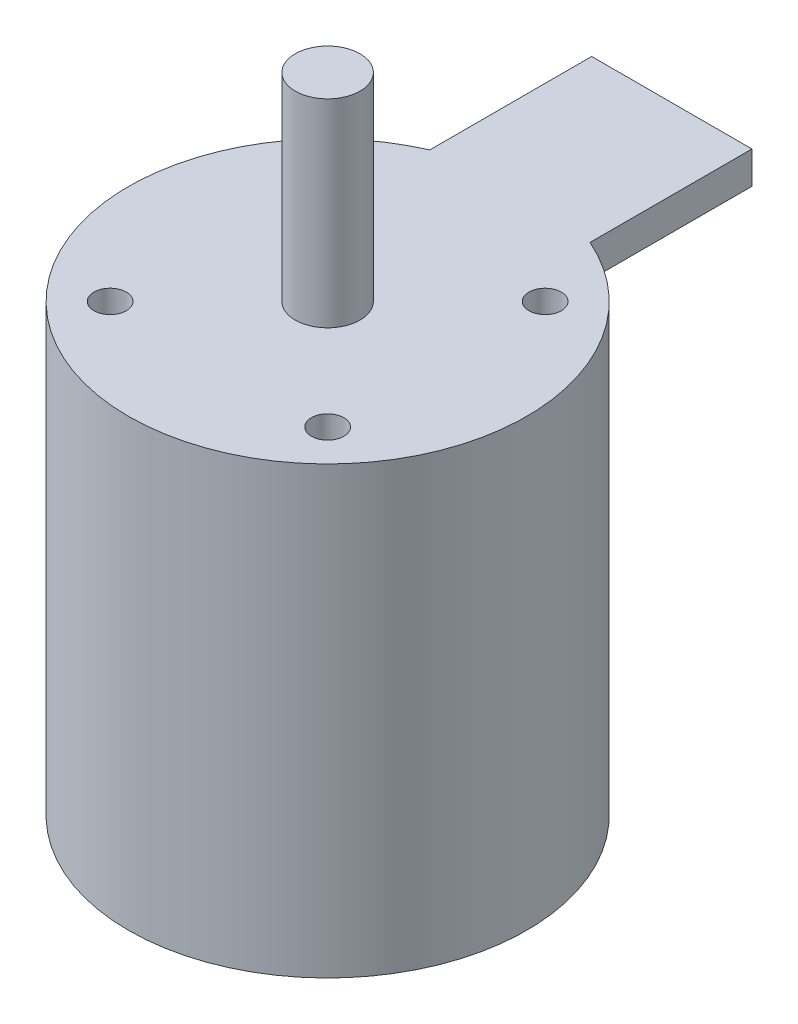
from build123d import *

# Parameters (mm, degrees)
SKETCH1_R           = 24.6
BOSS_EXTRUDE1_DEPTH = 55
SKETCH2_R           = 4
BOSS_EXTRUDE2_DEPTH = 24.5
SKETCH4_R           = 2
CUT_EXTRUDE1_DEPTH  = 5
SKETCH3_W           = 19.796892184
SKETCH3_H           = 20
BOSS_EXTRUDE4_DEPTH = 4


with BuildPart() as part:
    # Sketch1 → Boss-Extrude1 (new body)
    with BuildSketch(Plane(origin=(0, 0, 0), x_dir=(1, 0, 0), z_dir=(0, 1, 0))):
        Circle(SKETCH1_R)
    extrude(amount=BOSS_EXTRUDE1_DEPTH)

    # Sketch2 → Boss-Extrude2 (add)
    with BuildSketch(Plane(origin=(0, 55, 0), x_dir=(1, 0, 0), z_dir=(0, 1, 0))):
        Circle(SKETCH2_R)
    extrude(amount=BOSS_EXTRUDE2_DEPTH)

    # Sketch4 → Cut-Extrude1 (cut)
    with BuildSketch(Plane(origin=(0, 55, 0), x_dir=(1, 0, 0), z_dir=(0, 1, 0))):
        with Locations((-13.435028843, 13.435028843)):
            Circle(SKETCH4_R)
        with Locations((13.435028843, 13.435028843)):
            Circle(SKETCH4_R)
        with Locations((13.435028843, -13.435028843)):
            Circle(SKETCH4_R)
        with Locations((-13.435028843, -13.435028843)):
            Circle(SKETCH4_R)
    extrude(amount=-CUT_EXTRUDE1_DEPTH, mode=Mode.SUBTRACT)

    # Sketch3 → Boss-Extrude4 (add)
    with BuildSketch(Plane.XZ.offset(-55)):
        with Locations((0, -32.520674168)):
            Rectangle(SKETCH3_W, SKETCH3_H)
    extrude(amount=BOSS_EXTRUDE4_DEPTH)


solid = part.part
